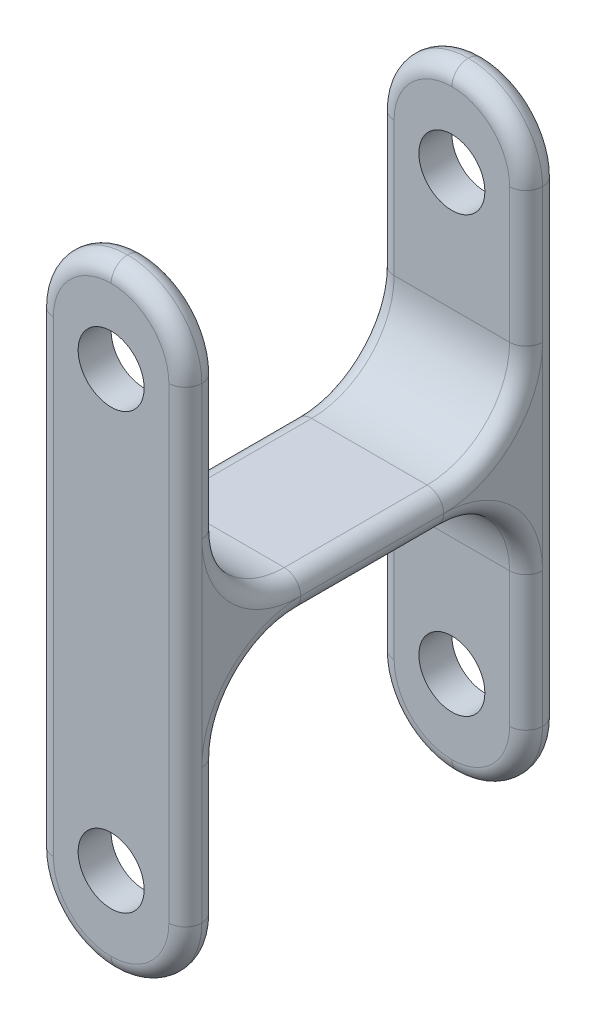
from build123d import *

# Parameters (mm, degrees)
BOSS_EXTRUDE1_DEPTH = 9
SKETCH2_R           = 2
CUT_EXTRUDE1_DEPTH  = 45.595416805
FILLET1_R           = 5
FILLET3_R           = 4.5
FILLET4_R           = 1


with BuildPart() as part:
    # Sketch1 → Boss-Extrude1 (new body)
    with BuildSketch(Plane(origin=(0, 0, 0), x_dir=(0, 0, -1), z_dir=(1, 0, 0))):
        Polygon((0, 0), (0, -37.34), (2, -37.34), (2, -19.67), (20.66, -19.67), (20.66, -37.34), (22.66, -37.34), (22.66, 0), (20.66, 0), (20.66, -17.67), (2, -17.67), (2, 0), align=None)
    extrude(amount=BOSS_EXTRUDE1_DEPTH)

    # Sketch2 → Cut-Extrude1 (cut, through all)
    with BuildSketch(Plane.XY):
        with Locations((4.5, -5.5)):
            Circle(SKETCH2_R)
        with Locations((4.5, -31.84)):
            Circle(SKETCH2_R)
    extrude(amount=-CUT_EXTRUDE1_DEPTH, mode=Mode.SUBTRACT)

    # Fillet1
    fillet1_edges = [part.edges().sort_by_distance(p)[0] for p in [
        (4.5, -17.67, -2),
        (4.5, -17.67, -20.66),
        (4.5, -19.67, -20.66),
        (4.5, -19.67, -2),
    ]]
    fillet(fillet1_edges, radius=FILLET1_R)

    # Fillet3
    fillet3_edges = [part.edges().sort_by_distance(p)[0] for p in [
        (9, 0, -1),
        (0, 0, -1),
        (9, 0, -21.66),
        (0, 0, -21.66),
        (0, -37.34, -1),
        (9, -37.34, -1),
        (9, -37.34, -21.66),
        (0, -37.34, -21.66),
    ]]
    fillet(fillet3_edges, radius=FILLET3_R - 0.0001)  # a hair under: the kernel refuses the full size

    # Fillet4
    fillet4_edges = [part.edges().sort_by_distance(p)[0] for p in [
        (7.682009805, -36.022009805, -22.66),
        (1.317990195, -36.022009805, -22.66),
        (0, -18.67, -22.66),
        (1.317990195, -1.317990195, -22.66),
        (7.682009805, -1.317990195, -22.66),
        (7.682009805, -1.317990195, 0),
        (1.317990195, -1.317990195, 0),
        (0, -18.67, 0),
        (1.317990195, -36.022009805, 0),
        (7.682009805, -36.022009805, 0),
        (9, -19.67, -11.33),
        (9, -21.134466094, -3.464466094),
        (9, -28.75505, -2),
        (7.682009805, -36.022009805, -2),
        (1.317990195, -36.022009805, -2),
        (0, -28.75505, -2),
        (0, -21.134466094, -3.464466094),
        (0, -19.67, -11.33),
        (0, -21.134466094, -19.195533906),
        (0, -28.75505, -20.66),
        (1.317990195, -36.022009805, -20.66),
        (7.682009805, -36.022009805, -20.66),
        (9, -28.75505, -20.66),
        (9, -8.58495, -20.66),
        (7.682009805, -1.317990195, -20.66),
        (1.317990195, -1.317990195, -20.66),
        (0, -8.58495, -20.66),
        (0, -16.205533906, -19.195533906),
        (0, -17.67, -11.33),
        (0, -16.205533906, -3.464466094),
        (0, -8.58495, -2),
        (1.317990195, -1.317990195, -2),
        (7.682009805, -1.317990195, -2),
        (9, -8.58495, -2),
        (9, -16.205533906, -3.464466094),
        (9, -17.67, -11.33),
        (9, -18.67, -22.66),
        (9, -18.67, 0),
        (9, -21.134466094, -19.195533906),
        (9, -16.205533906, -19.195533906),
    ]]
    fillet(fillet4_edges, radius=FILLET4_R - 0.0001)  # a hair under: the kernel refuses the full size


solid = part.part
